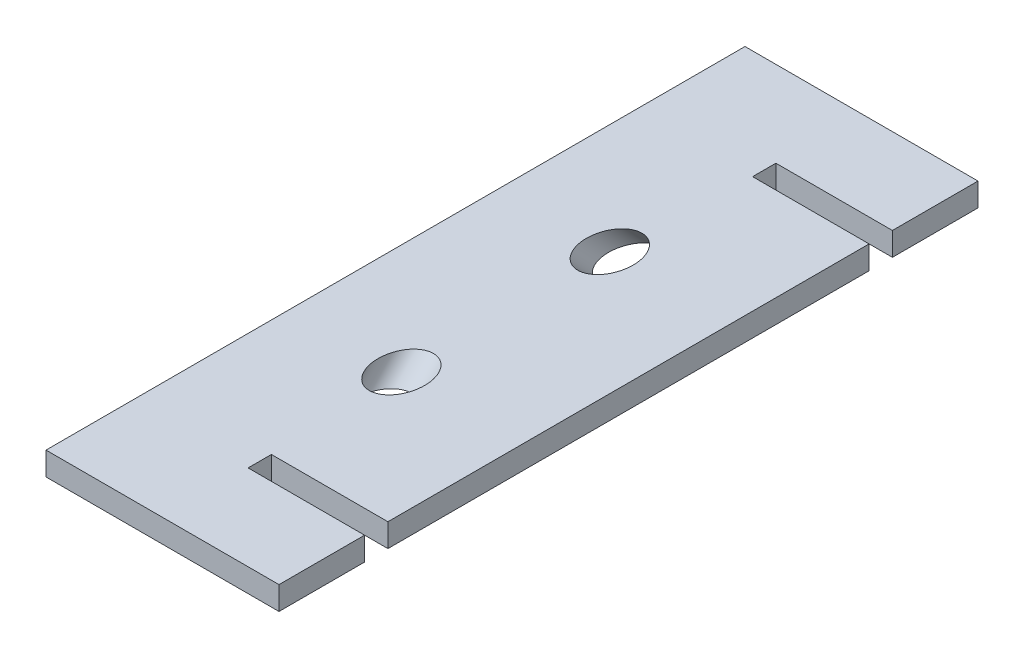
from build123d import *

# Parameters (mm, degrees)
BOSS_EXTRUDE1_DEPTH = 12.7
CAVITY1_START       = 98.335975301
CAVITY1_OUTLINE_R   = 12.7
CAVITY1_DEPTH       = 41.588388123
CAVITY1_2_OUTLINE_R = 12.7
CAVITY1_2_DEPTH     = 41.588388123


# Read off the part's stored shape, not the designer's step: Cavity1
with BuildPart() as part:
    # Sketch2 → Boss-Extrude1 (new body)
    with BuildSketch(Plane(origin=(0, 230.1, 0), x_dir=(1, 0, 0), z_dir=(0, 1, 0))):
        Polygon((2540, 190.5), (2667, 190.5), (2667, 143.842086105), (2603.5, 143.842086105), (2603.5, 131.142086105), (2667, 131.142086105), (2667, -131.142086105), (2603.5, -131.142086105), (2603.5, -143.842086105), (2667, -143.842086105), (2667, -190.5), (2540, -190.5), align=None)
    extrude(amount=-BOSS_EXTRUDE1_DEPTH)

    # Cavity1 outline → Cavity1 (cut)
    with BuildSketch(Plane(origin=(0, 0, 0), x_dir=(1, 0, 0), z_dir=(0, 0.7256238511734343, -0.6880915830092923)).offset(CAVITY1_START)):
        with Locations((2600, -199.546559073)):
            Circle(CAVITY1_OUTLINE_R)
    extrude(amount=CAVITY1_DEPTH, mode=Mode.SUBTRACT)

    # Cavity1 2 outline → Cavity1 2 (cut)
    with BuildSketch(Plane(origin=(0, 0, 0), x_dir=(1, 0, 0), z_dir=(0, 0.7256238511734294, 0.6880915830092974)).offset(CAVITY1_START)):
        with Locations((2600, 199.546559073)):
            Circle(CAVITY1_2_OUTLINE_R)
    extrude(amount=CAVITY1_2_DEPTH, mode=Mode.SUBTRACT)


solid = part.part
